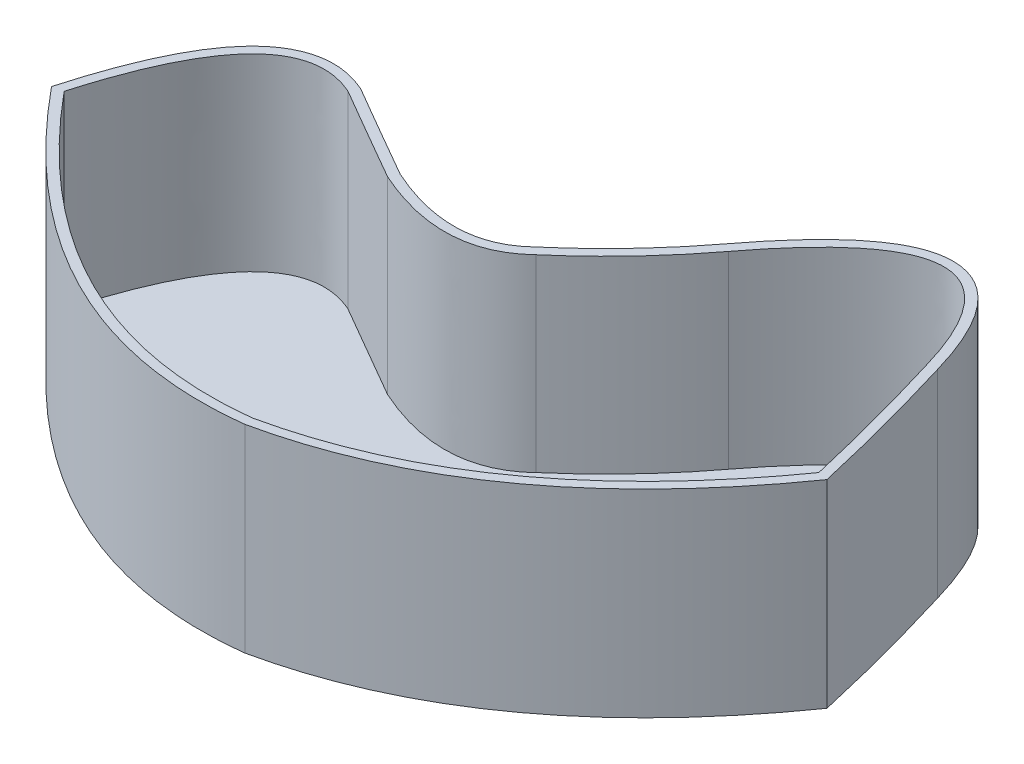
from build123d import *

# Parameters (mm, degrees)
SALIENTE_EXTRUIR1_DEPTH = 2
SALIENTE_EXTRUIR2_START = -2
SALIENTE_EXTRUIR2_DEPTH = 42


with BuildPart() as part:
    # Croquis4 → Saliente-Extruir1 (new body)
    with BuildSketch(Plane(origin=(0, 0, 0), x_dir=(1, 0, 0), z_dir=(0, 1, 0))):
        with BuildLine():
            add(Edge.make_bspline(
                [(52.710297529, 99.582127302), (63.756561517, 138.081595195), (82.710297529, 129.735907435)],
                knots=[0, 0, 0, 0.959481385, 0.959481385, 0.959481385], degree=2))
            add(Edge.make_bspline(
                [(52.710297529, 99.582127302), (90.126545005, 54.518849823), (132.710297529, 59.582127302)],
                knots=[0, 0, 0, 0.796718819, 0.796718819, 0.796718819], degree=2))
            add(Edge.make_bspline(
                [(202.710297529, 109.582127302), (173.420126191, 68.358434503), (132.710297529, 59.582127302)],
                knots=[0, 0, 0, 0.720516106, 0.720516106, 0.720516106], degree=2))
            add(Edge.make_bspline(
                [(194.454170212, 140.507214192), (199.136053193, 125.204121307), (202.710297529, 109.582127302)],
                knots=[0, 0, 0, 0.675598466, 0.675598466, 0.675598466], degree=2))
            add(Edge.make_bspline(
                [(152.449897532, 140.507214192), (182.808256429, 180.784913915), (194.454170212, 140.507214192)],
                knots=[0, 0, 0, 1, 1, 1], degree=2))
            add(Edge.make_bspline(
                [(132.710297529, 119.582127302), (140.11488779, 125.935824124), (146.690299112, 132.884341967), (152.449897532, 140.507214192)],
                knots=[0, 0, 0, 0, 0.833964402, 0.833964402, 0.833964402, 0.833964402], degree=3))
            add(Edge.make_bspline(
                [(102.65877087, 118.201219927), (122.100312055, 109.428474087), (132.710297529, 119.582127302)],
                knots=[0, 0, 0, 0.908986228, 0.908986228, 0.908986228], degree=2))
            add(Edge.make_bspline(
                [(82.710297529, 129.735907435), (92.671997726, 123.923322823), (102.65877087, 118.201219927)],
                knots=[0, 0, 0, 0.910186202, 0.910186202, 0.910186202], degree=2))
        make_face()
    extrude(amount=SALIENTE_EXTRUIR1_DEPTH)


with BuildPart() as saliente_extruir2_tool:
    # Croquis19 → Saliente-Extruir2 (new body)
    with BuildSketch(Plane(origin=(0, 2, 0), x_dir=(1, 0, 0), z_dir=(0, 1, 0)).offset(SALIENTE_EXTRUIR2_START)):
        with BuildLine():
            ThreePointArc((83.62236865, 131.519291558), (93.584161606, 125.732410099), (103.568713537, 119.984885532))
            add(Edge.make_bspline(
                [(131.365719965, 121.063748092), (130.971888683, 120.684835363), (130.142632133, 119.9517928), (128.438784912, 118.697522102), (126.162778494, 117.462528487), (123.183412129, 116.506911998), (119.912471769, 116.071224684), (116.324809268, 116.172759218), (113.063366868, 116.72219656), (110.29220395, 117.449231612), (108.134536322, 118.139339847), (106.268418782, 118.837388441), (104.741437099, 119.467238276), (103.95605498, 119.810793101), (103.568713537, 119.984885532)],
                knots=[0.499479639, 0.499479639, 0.499479639, 0.499479639, 0.499622406, 0.499765174, 0.500050708, 0.500336242, 0.500621776, 0.500907311, 0.501192845, 0.501335612, 0.501478379, 0.501621146, 0.50169253, 0.501763914, 0.501763914, 0.501763914, 0.501763914], degree=3))
            add(Edge.make_bspline(
                [(150.95199089, 141.842528057), (149.526755213, 139.951249583), (146.571479335, 136.248825133), (141.830479534, 130.941084133), (136.787475181, 125.875234297), (133.19424387, 122.632759491), (131.365719965, 121.063748092)],
                knots=[-3.407e-05, -3.407e-05, -3.407e-05, -3.407e-05, 0.210052577, 0.420139224, 0.630225871, 0.840312518, 0.840312518, 0.840312518, 0.840312518], degree=3))
            add(Edge.make_bspline(
                [(196.371161118, 141.077635904), (196.248795755, 141.500563841), (195.995397252, 142.352285229), (195.48073896, 143.986147771), (194.809972536, 145.941130105), (193.963876481, 148.134691236), (192.777490455, 150.861896983), (191.18107336, 153.901083064), (188.359000505, 157.974905621), (184.238162706, 161.603811097), (178.221700824, 163.150703065), (172.92813627, 161.916340062), (168.615333395, 159.654290079), (165.303845353, 157.336157381), (161.897909374, 154.406523973), (158.966988471, 151.456103514), (156.561279242, 148.789333407), (154.72613836, 146.636533397), (153.168453014, 144.712387311), (151.909452091, 143.100825644), (151.267942364, 142.260777118), (150.95199089, 141.842528057)],
                knots=[0.497988609, 0.497988609, 0.497988609, 0.497988609, 0.498059528, 0.498130447, 0.498272286, 0.498414124, 0.498555962, 0.498839638, 0.499123315, 0.499690668, 0.500258021, 0.500825374, 0.50110905, 0.501392727, 0.501676403, 0.501960079, 0.502101918, 0.502243756, 0.502385594, 0.502456513, 0.502527432, 0.502527432, 0.502527432, 0.502527432], degree=3))
            add(Edge.make_bspline(
                [(204.858492638, 109.156288537), (204.249367291, 111.843236182), (202.981172007, 117.207552496), (200.93288469, 125.208306826), (198.73765845, 133.167598608), (197.176202956, 138.445971282), (196.371161118, 141.077635904)],
                knots=[0.499571789, 0.499571789, 0.499571789, 0.499571789, 0.499709653, 0.499847517, 0.499985381, 0.500123245, 0.500123245, 0.500123245, 0.500123245], degree=3))
            add(Edge.make_bspline(
                [(133.039987072, 57.607298121), (136.517017027, 58.353588239), (143.410304061, 60.211208361), (153.331921439, 64.042793156), (162.890265106, 68.929810065), (172.064001952, 74.864194253), (180.854741648, 81.841702982), (187.85941484, 88.520970761), (193.271403672, 94.381452844), (197.234097167, 99.034056041), (200.458372672, 103.128234116), (202.986483638, 106.526999655), (204.241393684, 108.278784185), (204.858492638, 109.156288537)],
                knots=[0.499550345, 0.499550345, 0.499550345, 0.499550345, 0.499920524, 0.500290703, 0.500660881, 0.50103106, 0.501401239, 0.501771418, 0.501956507, 0.502141596, 0.502326686, 0.50241923, 0.502511775, 0.502511775, 0.502511775, 0.502511775], degree=3))
            add(Edge.make_bspline(
                [(50.499998363, 99.117827857), (51.28713851, 98.159265707), (52.890478228, 96.244606437), (56.086666196, 92.579661214), (60.120878243, 88.23562625), (65.006762747, 83.424905696), (71.588596042, 77.539618496), (79.941105501, 71.180357421), (90.169736046, 65.152928032), (100.604072147, 60.742602073), (111.233689738, 57.963400667), (120.24760203, 57.016603306), (127.525650082, 57.079807576), (131.212661015, 57.387753526), (133.039987072, 57.607298121)],
                knots=[0.497081408, 0.497081408, 0.497081408, 0.497081408, 0.49719343, 0.497305453, 0.497529497, 0.497753542, 0.497977587, 0.498425676, 0.498873765, 0.499321855, 0.499769944, 0.500218033, 0.500442078, 0.500666123, 0.500666123, 0.500666123, 0.500666123], degree=3))
            add(Edge.make_bspline(
                [(83.62236865, 131.519291558), (83.190564237, 131.711951172), (82.306221846, 132.074777828), (80.565610632, 132.658261641), (78.390963008, 133.138657799), (75.809004868, 133.290414791), (72.428155416, 132.910719977), (68.40918787, 131.337949061), (64.074405033, 127.853972923), (60.176273009, 122.906250357), (57.22522126, 117.581734073), (55.018923032, 112.59516445), (53.438684901, 108.492028222), (52.179464056, 104.761070862), (51.210491315, 101.605518316), (50.730590106, 99.941775987), (50.499998363, 99.117827857)],
                knots=[0.499165355, 0.499165355, 0.499165355, 0.499165355, 0.49927472, 0.499384085, 0.499602815, 0.499821545, 0.500040276, 0.500477736, 0.500915196, 0.501352656, 0.501790116, 0.502008846, 0.502227576, 0.502446306, 0.502555671, 0.502665036, 0.502665036, 0.502665036, 0.502665036], degree=3))
        make_face()
        with BuildLine():
            ThreePointArc((82.71029754, 129.73590743), (92.673161251, 123.948894915), (102.658770868, 118.201219928))
            add(Edge.make_bspline(
                [(132.710297529, 119.582127302), (122.100312054, 109.428474087), (102.658770868, 118.201219928)],
                knots=[0, 0, 0, 1, 1, 1], degree=2))
            add(Edge.make_bspline(
                [(152.54853475, 140.637933075), (146.765405271, 132.963757867), (140.157191664, 125.972124037), (132.710297529, 119.582127302)],
                knots=[0, 0, 0, 0, 0.838729004, 0.838729004, 0.838729004, 0.838729004], degree=3))
            add(Edge.make_bspline(
                [(194.454170212, 140.507214192), (182.827185257, 180.719448068), (152.54853475, 140.637933075)],
                knots=[0, 0, 0, 1, 1, 1], degree=2))
            add(Edge.make_bspline(
                [(202.710297591, 109.58212739), (199.136053222, 125.204121351), (194.454170212, 140.507214192)],
                knots=[0, 0, 0, 1, 1, 1], degree=2))
            add(Edge.make_bspline(
                [(132.710297645, 59.582127316), (173.420126277, 68.358434565), (202.710297591, 109.58212739)],
                knots=[0, 0, 0, 1, 1, 1], degree=2))
            add(Edge.make_bspline(
                [(52.710297498, 99.582127194), (90.126545043, 54.518849734), (132.710297645, 59.582127316)],
                knots=[0, 0, 0, 1, 1, 1], degree=2))
            add(Edge.make_bspline(
                [(82.71029754, 129.73590743), (63.756561494, 138.081595218), (52.710297498, 99.582127194)],
                knots=[0, 0, 0, 1, 1, 1], degree=2))
        make_face(mode=Mode.SUBTRACT)
    extrude(amount=SALIENTE_EXTRUIR2_DEPTH)


with BuildPart() as part_1:
    add(part.part)


with BuildPart() as part_2:
    # Saliente-Extruir2: joined with saliente_extruir2_tool
    add(part_1.part.fuse(saliente_extruir2_tool.part, tol=0.00001))


solid = part_2.part
